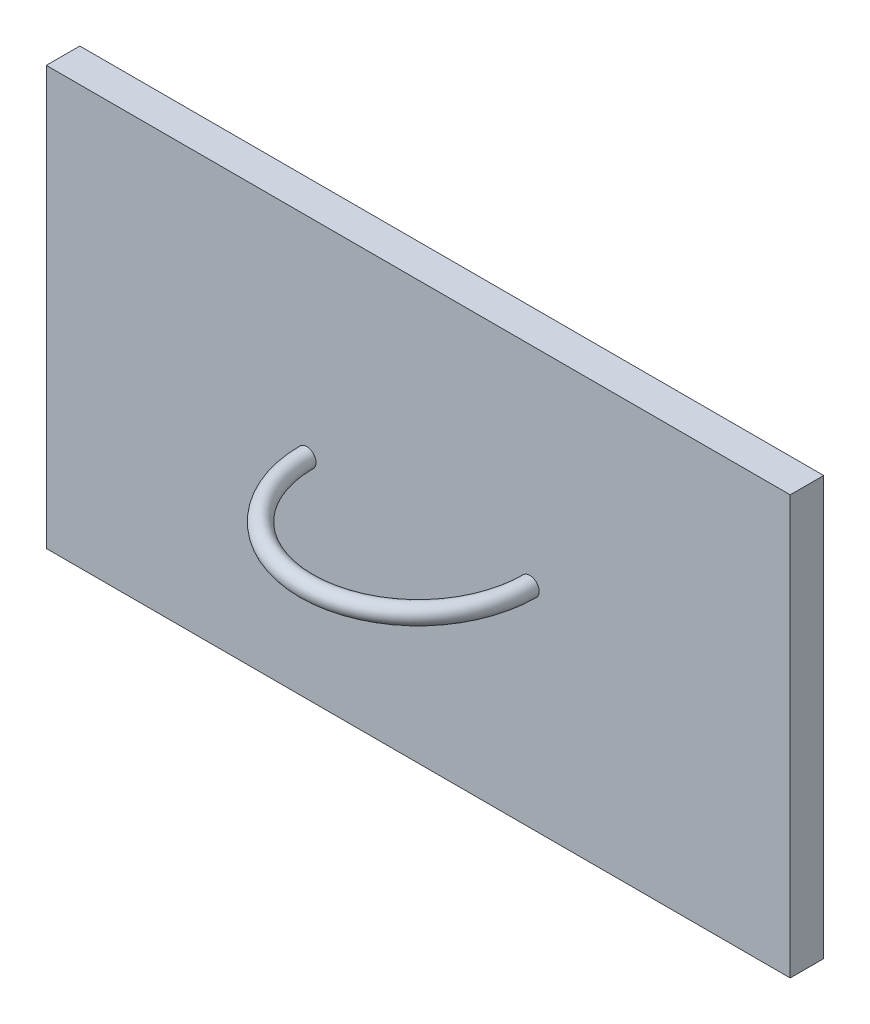
from build123d import *

# Parameters (mm, degrees)
SKETCH1_W           = 400
SKETCH1_H           = 225
BOSS_EXTRUDE1_DEPTH = 18
SWEEP1_OUTLINE_R    = 5
SWEEP1_ANGLE        = 180


# Read off the part's stored shape, not the designer's step: Sweep1
with BuildPart() as part:
    # Sketch1 → Boss-Extrude1 (new body)
    with BuildSketch(Plane.XY):
        with Locations((200, 112.5)):
            Rectangle(SKETCH1_W, SKETCH1_H)
    extrude(amount=BOSS_EXTRUDE1_DEPTH)

    # Sweep1 outline → Sweep1 (revolve)
    with BuildSketch(Plane(origin=(200, 0, 18), x_dir=(-1, 0, 0), z_dir=(0, 0, -1))):
        with Locations((60, 112.5)):
            Circle(SWEEP1_OUTLINE_R)
    revolve(axis=Axis((200, 0, 18), (0, 1, 0)), revolution_arc=SWEEP1_ANGLE)


solid = part.part
